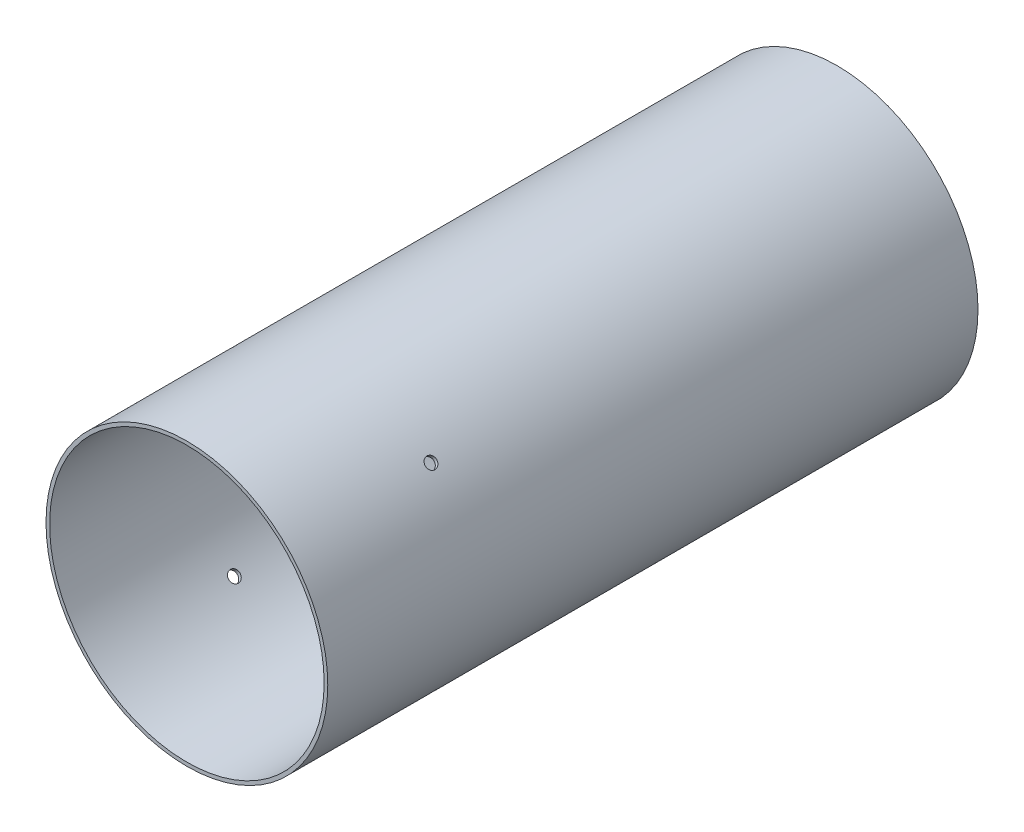
from build123d import *

# Parameters (mm, degrees)
SKETCH1_R           = 49.53
SKETCH1_R_2         = 48.26
BOSS_EXTRUDE1_DEPTH = 228.6
SKETCH2_R           = 1.984375
CUT_EXTRUDE1_DEPTH  = 12.7
CIRPATTERN1_COUNT   = 4
SKETCH3_R           = 2.38125
CUT_EXTRUDE2_DEPTH  = 25.4


with BuildPart() as part:
    # Sketch1 → Boss-Extrude1 (new body)
    with BuildSketch(Plane.XY):
        Circle(SKETCH1_R)
        Circle(SKETCH1_R_2, mode=Mode.SUBTRACT)
    extrude(amount=BOSS_EXTRUDE1_DEPTH)

    # Sketch2 → Cut-Extrude1 (cut)
    with BuildSketch(Plane(origin=(-120.58027232, -48.738223352, -78.995371644), x_dir=(0.7071067811865487, 0.7071067811865465, 0), z_dir=(-0.7071067811865465, 0.7071067811865487, 0))):
        with Locations((119.72625647, -256.795371644)):
            Circle(SKETCH2_R)
    cut_extrude1 = extrude(amount=-CUT_EXTRUDE1_DEPTH, mode=Mode.SUBTRACT)

    # CirPattern1: Cut-Extrude1 ×4 about axis
    cirpattern1_axis = Axis((0, 0, 0), (0, 0, -1))
    for i in range(1, CIRPATTERN1_COUNT):
        add(cut_extrude1.rotate(cirpattern1_axis, i * 360 / CIRPATTERN1_COUNT), mode=Mode.SUBTRACT)

    # Sketch3 → Cut-Extrude2 (cut)
    with BuildSketch(Plane(origin=(-108.021767186, -85.49918909, -79.333156205), x_dir=(0, 0, 1), z_dir=(-0.8660254037844379, 0.5000000000000014, 0))):
        with Locations((196.808156205, 128.055353348)):
            Circle(SKETCH3_R)
        with Locations((190.458156205, 128.055353348)):
            Circle(SKETCH3_R)
    extrude(amount=-CUT_EXTRUDE2_DEPTH, mode=Mode.SUBTRACT)


solid = part.part
